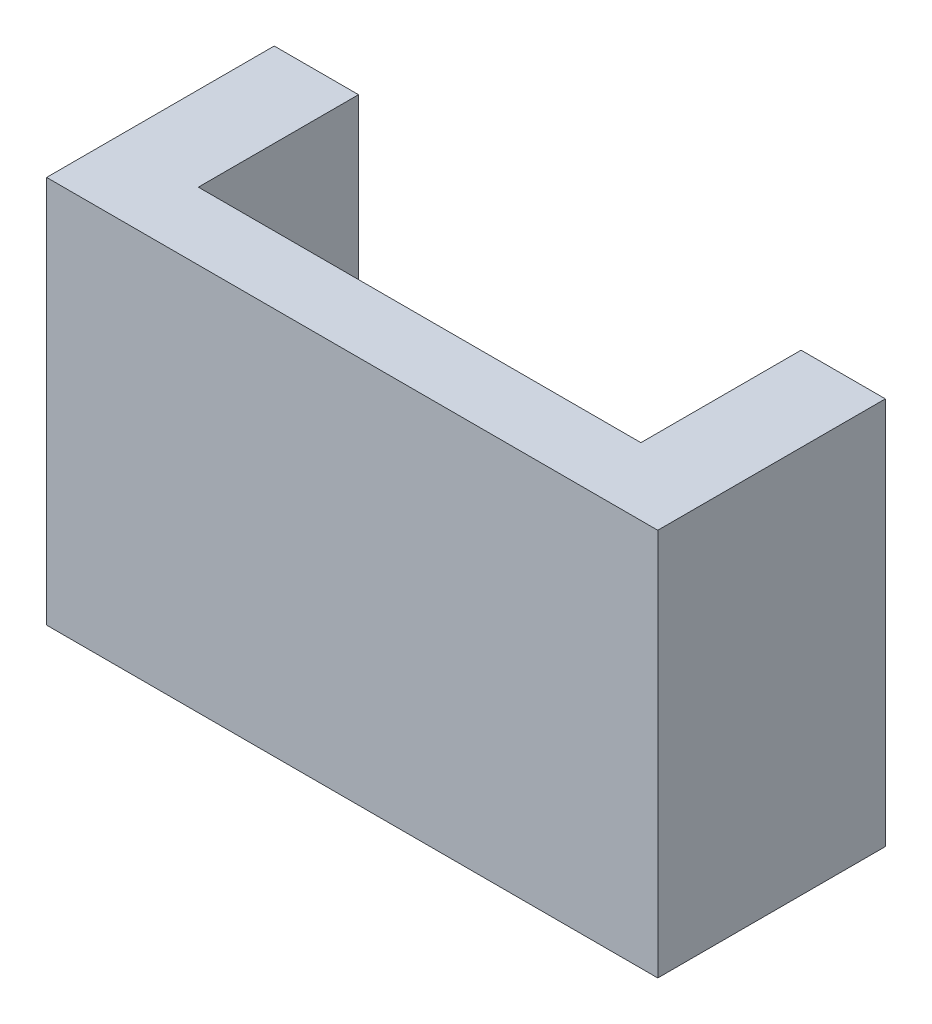
from build123d import *

# Parameters (mm, degrees)
SKETCH_1_W      = 10.5
SKETCH_1_H      = 8.6
EXTRUDE_1_DEPTH = 0.6
SKETCH_2_W      = 2
SKETCH_2_H      = 8.6
EXTRUDE_2_DEPTH = 5.4
EXTRUDE_3_DEPTH = 1
SKETCH_4_W      = 10.5
SKETCH_4_H      = 1
EXTRUDE_4_DEPTH = 1
CHAMFER_1_SIZE  = 0.4


with BuildPart() as part:
    # Эскиз1 → Бобышка-Вытянуть1 (new body)
    with BuildSketch(Plane.XY):
        with Locations((5.25, -4.3)):
            Rectangle(SKETCH_1_W, SKETCH_1_H)
    extrude(amount=EXTRUDE_1_DEPTH)

    # Эскиз2 → Бобышка-Вытянуть2 (add)
    with BuildSketch(Plane.XY.offset(0.6)):
        with Locations((-1, -4.3)):
            Rectangle(SKETCH_2_W, SKETCH_2_H)
        with Locations((11.5, -4.3)):
            Rectangle(SKETCH_2_W, SKETCH_2_H)
    extrude(amount=-EXTRUDE_2_DEPTH)

    # Эскиз3 → Бобышка-Вытянуть3 (add)
    with BuildSketch(Plane.XZ.offset(8.6)):
        Polygon((10.5, 0), (10.5, -4.8), (12.5, -4.8), (12.5, 0.6), (-2, 0.6), (-2, -4.8), (0, -4.8), (0, 0), align=None)
    extrude(amount=EXTRUDE_3_DEPTH)

    # Эскиз4 → Бобышка-Вытянуть4 (add)
    with BuildSketch(Plane(origin=(0, 0, 0), x_dir=(-1, 0, 0), z_dir=(0, 0, -1))):
        with Locations((-5.25, -0.5)):
            Rectangle(SKETCH_4_W, SKETCH_4_H)
    extrude(amount=EXTRUDE_4_DEPTH)

    # Фаска1
    # the kernel refuses this chamfer: 0.4 mm, written as the material it takes off along each edge
    with BuildSketch(Plane(origin=(0, -9.6, -5.828673195), x_dir=(0.02749587661058617, 0.9996219169112966, 0), z_dir=(0, 0, 1)), Plane(origin=(10.5, -9.6, 0), x_dir=(-0.027495876610587302, 0.9996219169112966, 0), z_dir=(0, 0, -1))) as chamfer_1_piece_1:
        Polygon((CHAMFER_1_SIZE * 0.999621916911, CHAMFER_1_SIZE * 0.0274958766106), (-CHAMFER_1_SIZE * 0.0274958766106, CHAMFER_1_SIZE * 0.999621916911), (0, 0), align=None)
    extrude(amount=5.828673195, mode=Mode.SUBTRACT)
    with BuildSketch(Plane(origin=(0, -9.6, 0), x_dir=(0, 0.9996219169112968, -0.027495876610582035), z_dir=(1, 0, 0))) as chamfer_1_piece_2:
        Polygon((CHAMFER_1_SIZE * 0.999621916911, CHAMFER_1_SIZE * 0.0274958766106), (-CHAMFER_1_SIZE * 0.0274958766106, CHAMFER_1_SIZE * 0.999621916911), (0, 0), align=None)
    extrude(amount=10.5, mode=Mode.SUBTRACT)
    with BuildSketch(Plane(origin=(9.471326805, -9.6, -4.8), x_dir=(0, 0.9996219169112966, -0.027495876610587302), z_dir=(1, 0, 0)), Plane(origin=(-3.028673195, -9.6, -4.8), x_dir=(0, 0.9996219169112966, -0.027495876610587302), z_dir=(1, 0, 0))) as chamfer_1_piece_3:
        Polygon((CHAMFER_1_SIZE * 0.999621916911, CHAMFER_1_SIZE * 0.0274958766106), (-CHAMFER_1_SIZE * 0.0274958766106, CHAMFER_1_SIZE * 0.999621916911), (0, 0), align=None)
    extrude(amount=4.05734639, mode=Mode.SUBTRACT)
    with BuildSketch(Plane(origin=(12.5, -9.6, -5.828673195), x_dir=(0.027495876610587302, 0.9996219169112966, 0), z_dir=(0, 0, 1)), Plane(origin=(-2, -9.6, 1.628673195), x_dir=(-0.027495876610586223, 0.9996219169112966, 0), z_dir=(0, 0, -1))) as chamfer_1_piece_4:
        Polygon((CHAMFER_1_SIZE * 0.999621916911, CHAMFER_1_SIZE * 0.0274958766106), (-CHAMFER_1_SIZE * 0.0274958766106, CHAMFER_1_SIZE * 0.999621916911), (0, 0), align=None)
    extrude(amount=7.45734639, mode=Mode.SUBTRACT)
    with BuildSketch(Plane(origin=(13.528673195, -9.6, 0.6), x_dir=(0, 0.9996219169112968, 0.027495876610586226), z_dir=(-1, 0, 0))) as chamfer_1_piece_5:
        Polygon((CHAMFER_1_SIZE * 0.999621916911, CHAMFER_1_SIZE * 0.0274958766106), (-CHAMFER_1_SIZE * 0.0274958766106, CHAMFER_1_SIZE * 0.999621916911), (0, 0), align=None)
    extrude(amount=16.55734639, mode=Mode.SUBTRACT)
    with BuildSketch(Plane(origin=(0, -9.6, -5.828673195), x_dir=(0.02749587661058617, 0.9996219169112966, 0), z_dir=(0, 0, 1))) as chamfer_1_piece_6a_section:
        Polygon((CHAMFER_1_SIZE * 0.999621916911, CHAMFER_1_SIZE * 0.0274958766106), (-CHAMFER_1_SIZE * 0.0274958766106, CHAMFER_1_SIZE * 0.999621916911), (0, 0), align=None)
    chamfer_1_piece_6a = extrude(amount=6.85734639, mode=Mode.PRIVATE)
    chamfer_1_piece_6a = split(chamfer_1_piece_6a, bisect_by=Plane(origin=(-0.131917451, -9.468082549, 0), z_dir=(0, 0, 1)), keep=Keep.TOP, mode=Mode.PRIVATE)
    with BuildSketch(Plane(origin=(-1.028673195, -9.6, 0), x_dir=(0, 0.9996219169112968, -0.027495876610586317), z_dir=(1, 0, 0))) as chamfer_1_piece_6b_section:
        Polygon((CHAMFER_1_SIZE * 0.999621916911, CHAMFER_1_SIZE * 0.0274958766106), (-CHAMFER_1_SIZE * 0.0274958766106, CHAMFER_1_SIZE * 0.999621916911), (0, 0), align=None)
    chamfer_1_piece_6b = extrude(amount=11.528673195, mode=Mode.PRIVATE)
    chamfer_1_piece_6b = split(chamfer_1_piece_6b, bisect_by=Plane(origin=(0, -9.468082549, 0.131917451), z_dir=(-1, 0, 0)), keep=Keep.TOP, mode=Mode.PRIVATE)
    chamfer_1_piece_6 = chamfer_1_piece_6a & chamfer_1_piece_6b
    add(chamfer_1_piece_6, mode=Mode.SUBTRACT)
    with BuildSketch(Plane(origin=(10.5, -9.6, 1.028673195), x_dir=(-0.027495876610587302, 0.9996219169112966, 0), z_dir=(0, 0, -1))) as chamfer_1_piece_7a_section:
        Polygon((CHAMFER_1_SIZE * 0.999621916911, CHAMFER_1_SIZE * 0.0274958766106), (-CHAMFER_1_SIZE * 0.0274958766106, CHAMFER_1_SIZE * 0.999621916911), (0, 0), align=None)
    chamfer_1_piece_7a = extrude(amount=6.85734639, mode=Mode.PRIVATE)
    chamfer_1_piece_7a = split(chamfer_1_piece_7a, bisect_by=Plane(origin=(10.631917451, -9.468082549, 0), z_dir=(0, 0, 1)), keep=Keep.TOP, mode=Mode.PRIVATE)
    with BuildSketch(Plane(origin=(0, -9.6, 0), x_dir=(0, 0.9996219169112968, -0.027495876610582035), z_dir=(1, 0, 0))) as chamfer_1_piece_7b_section:
        Polygon((CHAMFER_1_SIZE * 0.999621916911, CHAMFER_1_SIZE * 0.0274958766106), (-CHAMFER_1_SIZE * 0.0274958766106, CHAMFER_1_SIZE * 0.999621916911), (0, 0), align=None)
    chamfer_1_piece_7b = extrude(amount=11.528673195, mode=Mode.PRIVATE)
    chamfer_1_piece_7b = split(chamfer_1_piece_7b, bisect_by=Plane(origin=(10.5, -9.468082549, 0.131917451), z_dir=(1, 0, 0)), keep=Keep.TOP, mode=Mode.PRIVATE)
    chamfer_1_piece_7 = chamfer_1_piece_7a & chamfer_1_piece_7b
    add(chamfer_1_piece_7, mode=Mode.SUBTRACT)


solid = part.part
